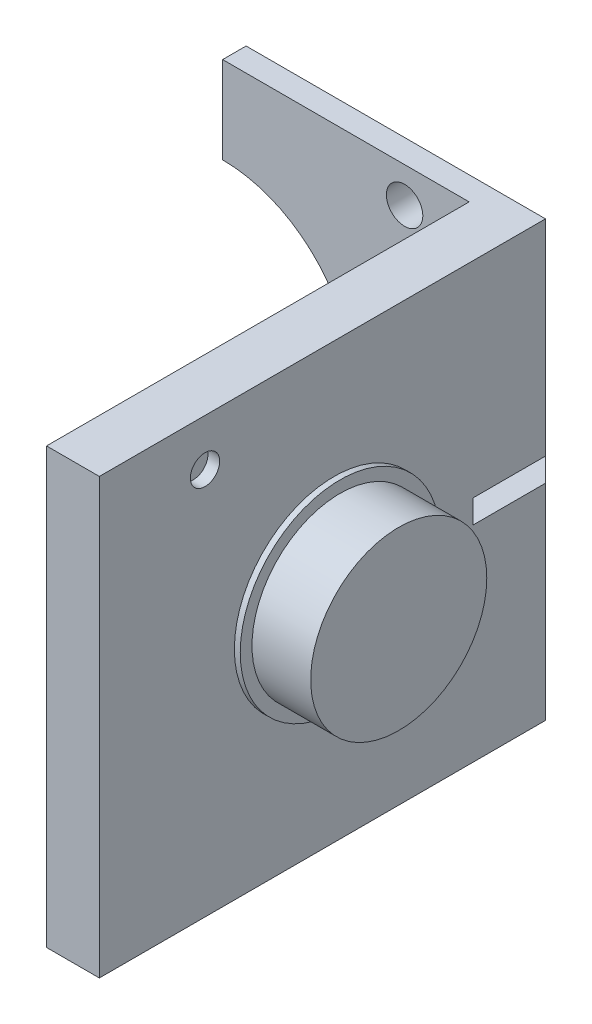
from build123d import *

# Parameters (mm, degrees)
SKETCH1_W           = 30
SKETCH1_H           = 37
BOSS_EXTRUDE1_DEPTH = 4.5
SKETCH2_W           = 4
SKETCH2_H           = 37
BOSS_EXTRUDE2_DEPTH = 42
SKETCH3_W           = 30
SKETCH3_H           = 37
BOSS_EXTRUDE3_DEPTH = 4.5
SKETCH8_R           = 11.1
CUT_EXTRUDE1_DEPTH  = 4
SKETCH9_R           = 1.55
CUT_EXTRUDE2_DEPTH  = 4
CHAMFER3_SIZE       = 2
SKETCH_6_R          = 7.5
EXTRUDE_2_DEPTH     = 5.5
SKETCH_5_R          = 4
EXTRUDE_1_DEPTH     = 20.5
SKETCH_15_R         = 8.5
EXTRUDE_6_DEPTH     = 0.5
EXTRUDE_START       = 0.5
SKETCH_16_R         = 8.5
SKETCH_16_R_2       = 7.45
EXTRUDE_7_DEPTH     = 0.5
SKETCH_17_W         = 4.5
SKETCH_17_H         = 37
EXTRUDE_8_DEPTH     = 10
SKETCH_23_R         = 1.25
CUT_EXTRUDE_4_DEPTH = 1
EXTRUDE_START_2     = -20.5
EXTRUDE_11_DEPTH    = 20.5
CUT_EXTRUDE_5_DEPTH = 67.219332525
SKETCH_27_W         = 8.159891724
SKETCH_27_H         = 2
CUT_EXTRUDE_6_DEPTH = 2


with BuildPart() as part:
    # Sketch1 → Boss-Extrude1 (new body)
    with BuildSketch(Plane(origin=(0, 0, 0), x_dir=(0, 0, -1), z_dir=(1, 0, 0))):
        with Locations((15, 18.5)):
            Rectangle(SKETCH1_W, SKETCH1_H)
    extrude(amount=BOSS_EXTRUDE1_DEPTH)

    # Sketch2 → Boss-Extrude2 (add)
    with BuildSketch(Plane.ZY):
        with Locations((-28, 18.5)):
            Rectangle(SKETCH2_W, SKETCH2_H)
    extrude(amount=BOSS_EXTRUDE2_DEPTH)

    # Sketch3 → Boss-Extrude3 (add)
    with BuildSketch(Plane.ZY.offset(42)):
        with Locations((-15, 18.5)):
            Rectangle(SKETCH3_W, SKETCH3_H)
    extrude(amount=BOSS_EXTRUDE3_DEPTH)

    # Sketch8 → Cut-Extrude1 (cut)
    with BuildSketch(Plane.XY.offset(-26)):
        with Locations((-21, 18.5)):
            Circle(SKETCH8_R)
    extrude(amount=-CUT_EXTRUDE1_DEPTH, mode=Mode.SUBTRACT)

    # Sketch9 → Cut-Extrude2 (cut)
    with BuildSketch(Plane(origin=(0, 0, -30), x_dir=(-1, 0, 0), z_dir=(0, 0, -1))):
        with Locations((5.5, 34)):
            Circle(SKETCH9_R)
        with Locations((36.5, 34)):
            Circle(SKETCH9_R)
        with Locations((36.5, 3)):
            Circle(SKETCH9_R)
        with Locations((5.5, 3)):
            Circle(SKETCH9_R)
    extrude(amount=-CUT_EXTRUDE2_DEPTH, mode=Mode.SUBTRACT)

    # Chamfer3
    # the kernel refuses this chamfer: 2 mm, written as the material it takes off along each edge
    with BuildSketch(Plane(origin=(4.5, -5.143365976, -30), x_dir=(0.02749587661058651, 0, 0.9996219169112968), z_dir=(0, 1, 0))) as chamfer3_piece_1:
        Polygon((CHAMFER3_SIZE * 0.999621916911, -CHAMFER3_SIZE * 0.0274958766106), (-CHAMFER3_SIZE * 0.0274958766106, -CHAMFER3_SIZE * 0.999621916911), (0, 0), align=None)
    extrude(amount=47.286731952, mode=Mode.SUBTRACT)
    with BuildSketch(Plane(origin=(-46.5, 42.143365976, -30), x_dir=(0.9996219169112968, 0, -0.027495876610585647), z_dir=(0, -1, 0))) as chamfer3_piece_2:
        Polygon((CHAMFER3_SIZE * 0.999621916911, CHAMFER3_SIZE * 0.0274958766106), (-CHAMFER3_SIZE * 0.0274958766106, CHAMFER3_SIZE * 0.999621916911), (0, 0), align=None)
    extrude(amount=47.286731952, mode=Mode.SUBTRACT)
    with BuildSketch(Plane(origin=(-51.643365976, 37, -30), x_dir=(0, -0.9996219169112968, -0.027495876610585647), z_dir=(1, 0, 0)), Plane(origin=(-51.643365976, 0, -30), x_dir=(0, -0.02749587661058639, 0.9996219169112968), z_dir=(1, 0, 0))) as chamfer3_piece_3:
        Polygon((CHAMFER3_SIZE * 0.999621916911, -CHAMFER3_SIZE * 0.0274958766106), (-CHAMFER3_SIZE * 0.0274958766106, -CHAMFER3_SIZE * 0.999621916911), (0, 0), align=None)
    extrude(amount=61.286731952, mode=Mode.SUBTRACT)

    # 草图6 → 凸台-拉伸2 (add)
    with BuildSketch(Plane(origin=(4.5, 0, 0), x_dir=(0, 0, -1), z_dir=(1, 0, 0))):
        with Locations((10, 18.5)):
            Circle(SKETCH_6_R)
    extrude(amount=EXTRUDE_2_DEPTH)

    # 草图5 → 凸台-拉伸1 (add)
    with BuildSketch(Plane.ZY.offset(46.5)):
        with Locations((-10, 18.5)):
            Circle(SKETCH_5_R)
    extrude(amount=EXTRUDE_1_DEPTH)

    # 草图15 → 凸台-拉伸6 (add)
    with BuildSketch(Plane.ZY.offset(46.5)):
        with Locations((-10, 18.5)):
            Circle(SKETCH_15_R)
    extrude(amount=EXTRUDE_6_DEPTH)

    # 草图16 → 凸台-拉伸7 (add)
    with BuildSketch(Plane(origin=(4.5, 0, 0), x_dir=(0, 0, -1), z_dir=(1, 0, 0)).offset(EXTRUDE_START)):
        with Locations(Location((10, 18.5, 0), (0, 0, 180))):
            Circle(SKETCH_16_R)
        with Locations((10, 18.5)):
            Circle(SKETCH_16_R_2, mode=Mode.SUBTRACT)
    extrude(amount=-EXTRUDE_7_DEPTH)

    # 草图17 → 凸台-拉伸8 (add)
    with BuildSketch(Plane.XY):
        with Locations((2.25, 18.5)):
            Rectangle(SKETCH_17_W, SKETCH_17_H)
    extrude(amount=EXTRUDE_8_DEPTH)

    # 草图23 → 切除-拉伸4 (cut)
    with BuildSketch(Plane(origin=(4.5, 0, 0), x_dir=(0, 0, -1), z_dir=(1, 0, 0))):
        with Locations((-1, 33)):
            Circle(SKETCH_23_R)
    extrude(amount=-CUT_EXTRUDE_4_DEPTH, mode=Mode.SUBTRACT)

    # 草图26 → 凸台-拉伸11 (add)
    with BuildSketch(Plane.ZY.offset(67).offset(EXTRUDE_START_2)):
        with BuildLine():
            ThreePointArc((-8.063508327, 22), (-10, 23.5), (-11.936491673, 22))
            ThreePointArc((-11.936491673, 22), (-10, 22.5), (-8.063508327, 22))
        make_face()
        with BuildLine():
            ThreePointArc((-13.5, 16.563508327), (-14, 18.5), (-13.5, 20.436491673))
            ThreePointArc((-13.5, 20.436491673), (-15, 18.5), (-13.5, 16.563508327))
        make_face()
        with BuildLine():
            ThreePointArc((-6.5, 16.563508327), (-5, 18.5), (-6.5, 20.436491673))
            ThreePointArc((-6.5, 20.436491673), (-6, 18.5), (-6.5, 16.563508327))
        make_face()
        with BuildLine():
            ThreePointArc((-8.063508327, 15), (-10, 14.5), (-11.936491673, 15))
            ThreePointArc((-11.936491673, 15), (-10, 13.5), (-8.063508327, 15))
        make_face()
    extrude(amount=EXTRUDE_11_DEPTH)

    # 草图25 → 切除-拉伸5 (cut, through all)
    with BuildSketch(Plane.ZY.offset(21)):
        Polygon((21.58280616, 37.67604856), (19.928852176, -12.32395144), (-38.530236753, -10.39017858), (-38.530236753, 37.67604856), align=None)
    extrude(amount=CUT_EXTRUDE_5_DEPTH, mode=Mode.SUBTRACT)

    # 草图27 → 切除-拉伸6 (cut)
    with BuildSketch(Plane(origin=(4.5, 0, 0), x_dir=(0, 0, -1), z_dir=(1, 0, 0))):
        with Locations((25.920054138, 18.5)):
            Rectangle(SKETCH_27_W, SKETCH_27_H)
    extrude(amount=-CUT_EXTRUDE_6_DEPTH, mode=Mode.SUBTRACT)


solid = part.part
